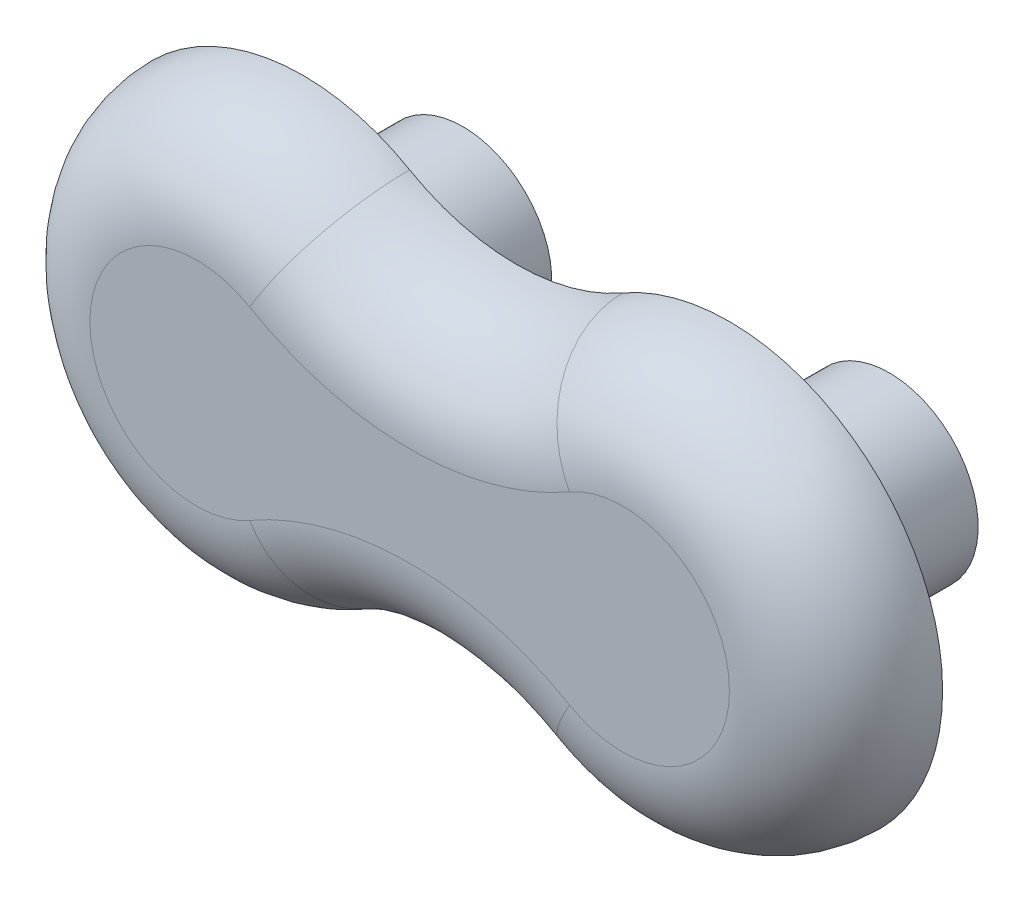
from build123d import *

# Parameters (mm, degrees)
EXTRUDE_START   = 4.5
EXTRUDE_1_DEPTH = 3
SKETCH_3_R      = 2.5
EXTRUDE_2_DEPTH = 4.5
SKETCH_6_R      = 3
EXTRUDE_3_DEPTH = 0.5
FILLET_1_R      = 3


with BuildPart() as part:
    # Эскиз2 → Бобышка-Вытянуть1 (new body)
    with BuildSketch(Plane.XY.offset(EXTRUDE_START)):
        with BuildLine():
            ThreePointArc((9, 5.196152423), (0, 0), (9, -5.196152423))
            ThreePointArc((9, -5.196152423), (12, -4.392304845), (15, -5.196152423))
            ThreePointArc((15, -5.196152423), (24, 0), (15, 5.196152423))
            ThreePointArc((15, 5.196152423), (12, 4.392304845), (9, 5.196152423))
        make_face()
    extrude(amount=EXTRUDE_1_DEPTH)

    # Эскиз3 → Бобышка-Вытянуть2 (add)
    with BuildSketch(Plane(origin=(0, 0, 4.5), x_dir=(-1, 0, 0), z_dir=(0, 0, -1))):
        with Locations(Location((-18, 0, 0), (0, 0, 180))):
            Circle(SKETCH_3_R)
        with Locations(Location((-6, 0, 0), (0, 0, 180))):
            Circle(SKETCH_3_R)
    extrude(amount=EXTRUDE_2_DEPTH)

    # Эскиз6 → Бобышка-Вытянуть3 (add)
    with BuildSketch(Plane(origin=(0, 0, 4.5), x_dir=(-1, 0, 0), z_dir=(0, 0, -1))):
        with Locations(Location((-18, 0, 0), (0, 0, 180))):
            Circle(SKETCH_6_R)
        with Locations(Location((-6, 0, 0), (0, 0, 180))):
            Circle(SKETCH_6_R)
    extrude(amount=EXTRUDE_3_DEPTH)

    # Скругление1
    fillet_1_edges = [part.edges().sort_by_distance(p)[0] for p in [
        (0, 0, 7.5),
        (12, 4.392304845, 7.5),
        (24, 0, 7.5),
        (12, -4.392304845, 7.5),
    ]]
    fillet(fillet_1_edges, radius=FILLET_1_R - 0.0001)  # a hair under: the kernel refuses the full size


solid = part.part
